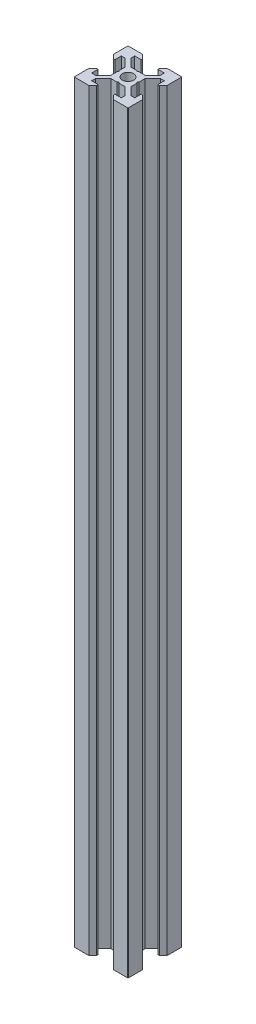
from build123d import *

# Parameters (mm, degrees)
ESQUISSE1_R        = 2.1
BOSS_EXTRU_1_DEPTH = 280


with BuildPart() as part:
    # Esquisse1 → Boss.-Extru.1 (new body)
    with BuildSketch(Plane(origin=(0, 0, 0), x_dir=(1, 0, 0), z_dir=(0, 1, 0))):
        with BuildLine():
            Line((3.7, 2.639339828), (6.560660172, 5.5))
            Line((6.560660172, 5.5), (8, 5.5))
            Line((8, 5.5), (8, 3.1))
            Line((8, 3.1), (8.52, 3.1))
            Line((8.52, 3.1), (10, 4.58))
            Line((10, 4.58), (10, 9.82))
            ThreePointArc((10, 9.82), (9.947279221, 9.947279221), (9.82, 10))
            Line((9.82, 10), (4.58, 10))
            Line((4.58, 10), (3.1, 8.52))
            Line((3.1, 8.52), (3.1, 8))
            Line((3.1, 8), (5.5, 8))
            Line((5.5, 8), (5.5, 6.560660172))
            Line((5.5, 6.560660172), (2.639339828, 3.7))
            Line((2.639339828, 3.7), (0.353553391, 3.7))
            Line((0.353553391, 3.7), (0, 3.346446609))
            Line((0, 3.346446609), (-0.353553391, 3.7))
            Line((-0.353553391, 3.7), (-2.639339828, 3.7))
            Line((-2.639339828, 3.7), (-5.5, 6.560660172))
            Line((-5.5, 6.560660172), (-5.5, 8))
            Line((-5.5, 8), (-3.1, 8))
            Line((-3.1, 8), (-3.1, 8.52))
            Line((-3.1, 8.52), (-4.58, 10))
            Line((-4.58, 10), (-9.82, 10))
            ThreePointArc((-9.82, 10), (-9.947279221, 9.947279221), (-10, 9.82))
            Line((-10, 9.82), (-10, 4.58))
            Line((-10, 4.58), (-8.52, 3.1))
            Line((-8.52, 3.1), (-8, 3.1))
            Line((-8, 3.1), (-8, 5.5))
            Line((-8, 5.5), (-6.560660172, 5.5))
            Line((-6.560660172, 5.5), (-3.7, 2.639339828))
            Line((-3.7, 2.639339828), (-3.7, 0.353553391))
            Line((-3.7, 0.353553391), (-3.346446609, 0))
            Line((-3.346446609, 0), (-3.7, -0.353553391))
            Line((-3.7, -0.353553391), (-3.7, -2.639339828))
            Line((-3.7, -2.639339828), (-6.560660172, -5.5))
            Line((-6.560660172, -5.5), (-8, -5.5))
            Line((-8, -5.5), (-8, -3.1))
            Line((-8, -3.1), (-8.52, -3.1))
            Line((-8.52, -3.1), (-10, -4.58))
            Line((-10, -4.58), (-10, -9.82))
            ThreePointArc((-10, -9.82), (-9.947279221, -9.947279221), (-9.82, -10))
            Line((-9.82, -10), (-4.58, -10))
            Line((-4.58, -10), (-3.1, -8.52))
            Line((-3.1, -8.52), (-3.1, -8))
            Line((-3.1, -8), (-5.5, -8))
            Line((-5.5, -8), (-5.5, -6.560660172))
            Line((-5.5, -6.560660172), (-2.639339828, -3.7))
            Line((-2.639339828, -3.7), (-0.353553391, -3.7))
            Line((-0.353553391, -3.7), (0, -3.346446609))
            Line((0, -3.346446609), (0.353553391, -3.7))
            Line((0.353553391, -3.7), (2.639339828, -3.7))
            Line((2.639339828, -3.7), (5.5, -6.560660172))
            Line((5.5, -6.560660172), (5.5, -8))
            Line((5.5, -8), (3.1, -8))
            Line((3.1, -8), (3.1, -8.52))
            Line((3.1, -8.52), (4.58, -10))
            Line((4.58, -10), (9.82, -10))
            ThreePointArc((9.82, -10), (9.947279221, -9.947279221), (10, -9.82))
            Line((10, -9.82), (10, -4.58))
            Line((10, -4.58), (8.52, -3.1))
            Line((8.52, -3.1), (8, -3.1))
            Line((8, -3.1), (8, -5.5))
            Line((8, -5.5), (6.560660172, -5.5))
            Line((6.560660172, -5.5), (3.7, -2.639339828))
            Line((3.7, -2.639339828), (3.7, -0.353553391))
            Line((3.7, -0.353553391), (3.346446609, 0))
            Line((3.346446609, 0), (3.7, 0.353553391))
            Line((3.7, 0.353553391), (3.7, 2.639339828))
        make_face()
        Circle(ESQUISSE1_R, mode=Mode.SUBTRACT)
    extrude(amount=BOSS_EXTRU_1_DEPTH)


solid = part.part
